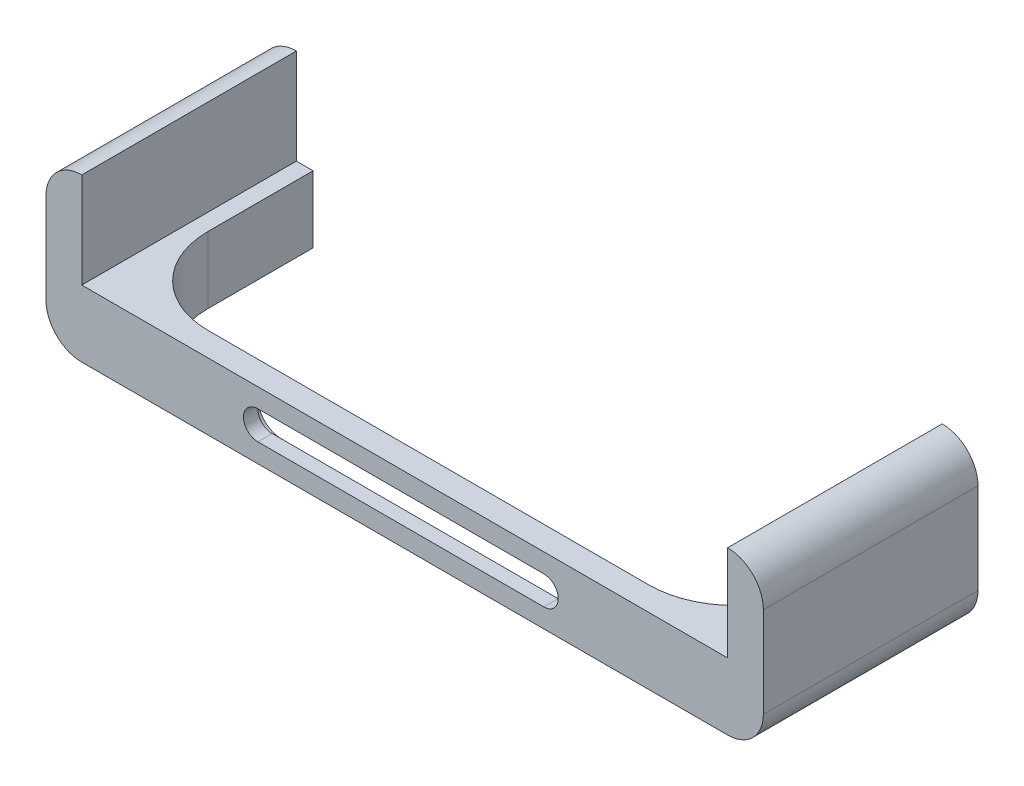
from build123d import *

# Parameters (mm, degrees)
BOSS_EXTRUDE1_DEPTH = 5
BOSS_EXTRUDE2_DEPTH = 40
CUT_EXTRUDE1_DEPTH  = 2
CUT_EXTRUDE2_DEPTH  = 370.382836634
FILLET1_R           = 18
FILLET2_R           = 7.5


with BuildPart() as part:
    # Sketch1 → Boss-Extrude1 (new body)
    with BuildSketch(Plane.XY):
        Polygon((67.7, -325.2), (75.2, -325.2), (75.2, -359.2), (-75.2, -359.2), (-75.2, -325.2), (-67.7, -325.2), (-67.7, -345.2), (67.7, -345.2), align=None)
    extrude(amount=-BOSS_EXTRUDE1_DEPTH)

    # Sketch2 → Boss-Extrude2 (add)
    with BuildSketch(Plane(origin=(0, 0, -5), x_dir=(-1, 0, 0), z_dir=(0, 0, -1))):
        Polygon((67.7, -325.2), (75.2, -325.2), (75.2, -359.2), (64.2, -359.2), (64.2, -345.2), (67.7, -345.2), align=None)
        Polygon((-75.2, -359.2), (-75.2, -325.2), (-67.7, -325.2), (-67.7, -345.2), (-64.2, -345.2), (-64.2, -359.2), align=None)
    extrude(amount=BOSS_EXTRUDE2_DEPTH)

    # Sketch3 → Cut-Extrude1 (cut)
    with BuildSketch(Plane(origin=(0, 0, -5), x_dir=(-1, 0, 0), z_dir=(0, 0, -1))):
        with BuildLine():
            Line((-29.2, -347.2), (30.8, -347.2))
            ThreePointArc((30.8, -347.2), (35.8, -352.2), (30.8, -357.2))
            Line((30.8, -357.2), (-29.2, -357.2))
            ThreePointArc((-29.2, -357.2), (-34.2, -352.2), (-29.2, -347.2))
        make_face()
    extrude(amount=-CUT_EXTRUDE1_DEPTH, mode=Mode.SUBTRACT)

    # Sketch4 → Cut-Extrude2 (cut, through all)
    with BuildSketch(Plane(origin=(0, 0, -3), x_dir=(-1, 0, 0), z_dir=(0, 0, -1))):
        with BuildLine():
            Line((-29.2, -349.2), (30.8, -349.2))
            ThreePointArc((30.8, -349.2), (33.8, -352.2), (30.8, -355.2))
            Line((30.8, -355.2), (-29.2, -355.2))
            ThreePointArc((-29.2, -355.2), (-32.2, -352.2), (-29.2, -349.2))
        make_face()
    extrude(amount=-CUT_EXTRUDE2_DEPTH, mode=Mode.SUBTRACT)

    # Fillet1
    fillet1_edges = [part.edges().sort_by_distance(p)[0] for p in [
        (-64.2, -352.2, -5),
        (64.2, -352.2, -5),
    ]]
    fillet(fillet1_edges, radius=FILLET1_R)

    # Fillet2
    fillet2_edges = [part.edges().sort_by_distance(p)[0] for p in [
        (75.2, -325.2, -22.5),
        (-75.2, -325.2, -22.5),
        (-75.2, -359.2, -22.5),
        (75.2, -359.2, -22.5),
    ]]
    fillet(fillet2_edges, radius=FILLET2_R - 0.0001)  # a hair under: the kernel refuses the full size


solid = part.part
